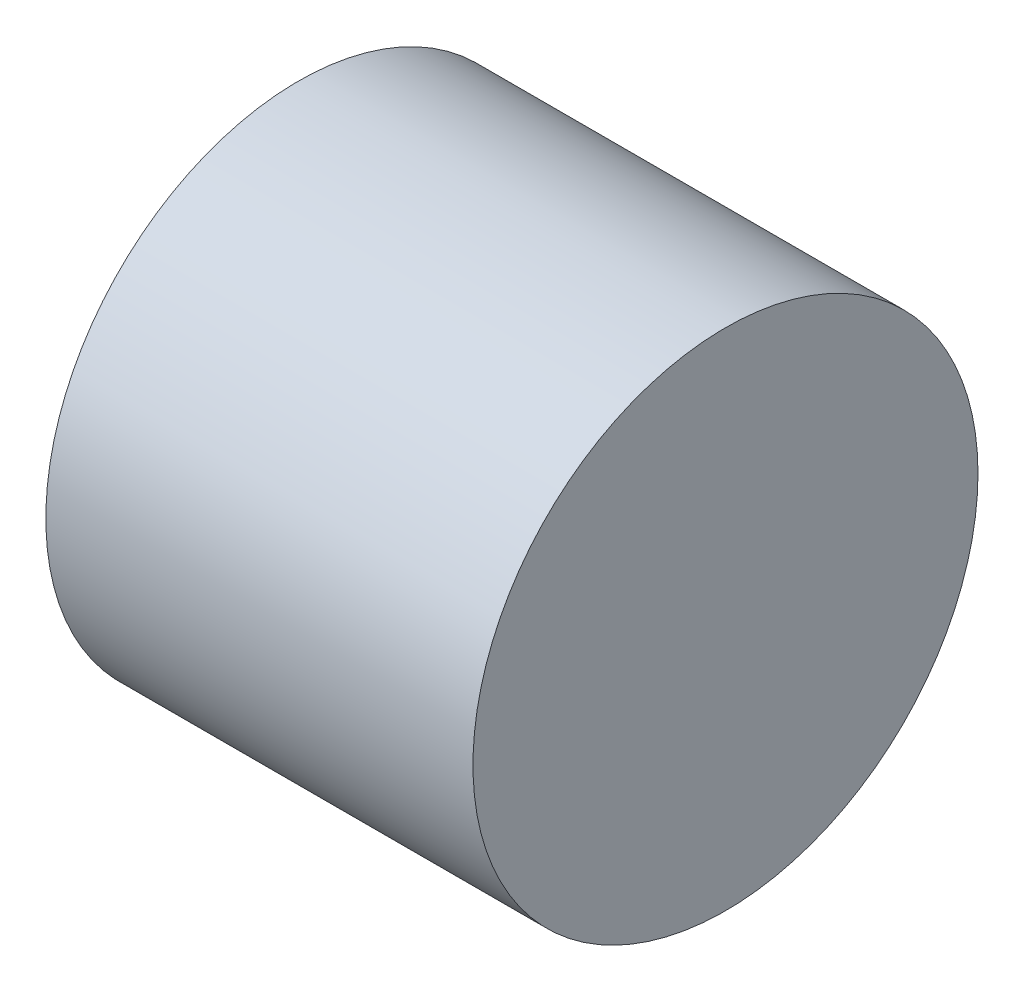
from build123d import *

# Parameters (mm, degrees)
BOSS_EXTRUDE1_DEPTH      = 14.8
BOSS_EXTRUDE1_DEPTH_BACK = 14.8
SKETCH2_R                = 17.5


with BuildPart() as part:
    # Sketch2 → Boss-Extrude1 (new, two sides: drawn at the far end of the back side and taken through both)
    with BuildSketch(Plane(origin=(0, 0, 0), x_dir=(0, 0, -1), z_dir=(1, 0, 0)).offset(-BOSS_EXTRUDE1_DEPTH_BACK)):
        with Locations((-2.5, 0)):
            Circle(SKETCH2_R)
    extrude(amount=BOSS_EXTRUDE1_DEPTH + BOSS_EXTRUDE1_DEPTH_BACK)


solid = part.part
